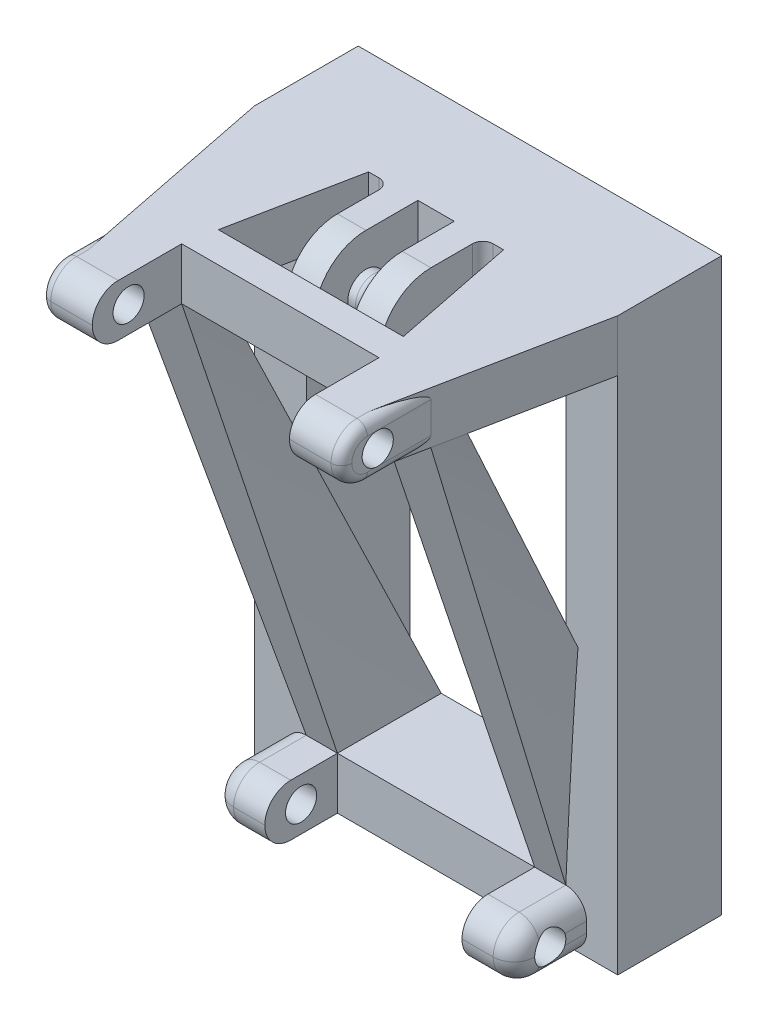
from build123d import *
from OCP.BRepFilletAPI import BRepFilletAPI_MakeChamfer

# Parameters (mm, degrees)
SKETCH1_W           = 35
SKETCH1_H           = 55
BOSS_EXTRUDE1_DEPTH = 3
SKETCH2_W           = 5
SKETCH2_H           = 5
BOSS_EXTRUDE2_DEPTH = 7
CUT_EXTRUDE1_REACH  = 45.362
FILLET1_R           = 2.5
SKETCH4_W           = 5
SKETCH4_H           = 5
BOSS_EXTRUDE3_DEPTH = 16.61764706
CUT_EXTRUDE2_REACH  = 51.887
FILLET2_R           = 2.5
FILLET3_R           = 2
CHAMFER1_SIZE       = 3
CHAMFER1_SIZE_2     = 15
FILLET5_R           = 1
SKETCH6_W           = 2.75
SKETCH6_H           = 10
BOSS_EXTRUDE4_DEPTH = 10
FILLET6_R           = 5
FILLET7_R           = 1
BOSS_EXTRUDE5_START = -2.75
BOSS_EXTRUDE5_DEPTH = 1.25
BOSS_EXTRUDE6_START = -4
BOSS_EXTRUDE6_DEPTH = 1.25
CHAMFER2_SIZE       = 3
CHAMFER2_SIZE2      = 15
BOSS_EXTRUDE7_REACH = 48.364
SKETCH10_W          = 3
SKETCH10_H          = 5
SKETCH15_W          = 35
SKETCH15_H          = 55
BOSS_EXTRUDE8_DEPTH = 7
CUT_EXTRUDE5_DEPTH  = 10
BOSS_EXTRUDE9_START = -5
SKETCH19_W          = 5
SKETCH19_H          = 10
BOSS_EXTRUDE9_DEPTH = 55


with BuildPart() as part:
    # Sketch1 → Boss-Extrude1 (new body)
    with BuildSketch(Plane.XY):
        Rectangle(SKETCH1_W, SKETCH1_H)
    extrude(amount=BOSS_EXTRUDE1_DEPTH)

    # Sketch2 → Boss-Extrude2 (add)
    with BuildSketch(Plane.XY.offset(3)):
        with Locations((-12, 25)):
            Rectangle(SKETCH2_W, SKETCH2_H)
        with Locations((12, 25)):
            Rectangle(SKETCH2_W, SKETCH2_H)
        with Locations((-12, -25)):
            Rectangle(SKETCH2_W, SKETCH2_H)
        with Locations((12, -25)):
            Rectangle(SKETCH2_W, SKETCH2_H)
    extrude(amount=BOSS_EXTRUDE2_DEPTH)

    # Cut-Extrude1: up to this face of the body (flat: up to its plane)
    cut_extrude1_end = Plane(part.part.faces().sort_by_distance((14.5, 25, 6.5))[0])
    # Sketch3 → Cut-Extrude1 (cut, up to the picked face)
    with BuildSketch(Plane.ZY.offset(14.5), mode=Mode.PRIVATE) as cut_extrude1_sk1:
        with BuildLine():
            ThreePointArc((8, -25), (6.957766147, -23.571556737), (5.279399793, -24.128142709))
            Line((5.279399793, -24.128142709), (7.720600207, -25.871857291))
            ThreePointArc((7.720600207, -25.871857291), (7.928443263, -25.457766147), (8, -25))
        make_face()
    cut_extrude1_tool1 = split(extrude(cut_extrude1_sk1.sketch, amount=-CUT_EXTRUDE1_REACH, mode=Mode.PRIVATE), bisect_by=cut_extrude1_end, keep=Keep.BOTH, mode=Mode.PRIVATE)
    # Sketch3 → Cut-Extrude1 (cut, up to the picked face)
    with BuildSketch(Plane.ZY.offset(14.5), mode=Mode.PRIVATE) as cut_extrude1_sk2:
        with BuildLine():
            Line((7.720600207, -25.871857291), (5.279399793, -24.128142709))
            ThreePointArc((5.279399793, -24.128142709), (5.628142709, -26.220600207), (7.720600207, -25.871857291))
        make_face()
    cut_extrude1_tool2 = split(extrude(cut_extrude1_sk2.sketch, amount=-CUT_EXTRUDE1_REACH, mode=Mode.PRIVATE), bisect_by=cut_extrude1_end, keep=Keep.BOTH, mode=Mode.PRIVATE)
    # Sketch3 → Cut-Extrude1 (cut, up to the picked face)
    with BuildSketch(Plane.ZY.offset(14.5), mode=Mode.PRIVATE) as cut_extrude1_sk3:
        with BuildLine():
            ThreePointArc((8, -25), (6.957766147, -23.571556737), (5.279399793, -24.128142709))
            Line((5.279399793, -24.128142709), (7.720600207, -25.871857291))
            ThreePointArc((7.720600207, -25.871857291), (7.928443263, -25.457766147), (8, -25))
        make_face()
    cut_extrude1_tool3 = split(extrude(cut_extrude1_sk3.sketch, amount=-CUT_EXTRUDE1_REACH, mode=Mode.PRIVATE), bisect_by=cut_extrude1_end, keep=Keep.BOTH, mode=Mode.PRIVATE)
    # Sketch3 → Cut-Extrude1 (cut, up to the picked face)
    with BuildSketch(Plane.ZY.offset(14.5), mode=Mode.PRIVATE) as cut_extrude1_sk4:
        with BuildLine():
            Line((7.720600207, -25.871857291), (5.279399793, -24.128142709))
            ThreePointArc((5.279399793, -24.128142709), (5.628142709, -26.220600207), (7.720600207, -25.871857291))
        make_face()
    cut_extrude1_tool4 = split(extrude(cut_extrude1_sk4.sketch, amount=-CUT_EXTRUDE1_REACH, mode=Mode.PRIVATE), bisect_by=cut_extrude1_end, keep=Keep.BOTH, mode=Mode.PRIVATE)
    add(cut_extrude1_tool1.solids().sort_by(Axis((-14.5, -24.481961, 6.870028), (1, 0, 0)))[0], mode=Mode.SUBTRACT)
    add(cut_extrude1_tool2.solids().sort_by(Axis((-14.5, -25.518039, 6.129972), (1, 0, 0)))[0], mode=Mode.SUBTRACT)
    add(cut_extrude1_tool3.solids().sort_by(Axis((-14.5, -24.481961, 6.870028), (1, 0, 0)))[0], mode=Mode.SUBTRACT)
    add(cut_extrude1_tool4.solids().sort_by(Axis((-14.5, -25.518039, 6.129972), (1, 0, 0)))[0], mode=Mode.SUBTRACT)

    # Fillet1
    fillet1_edges = [part.edges().sort_by_distance(p)[0] for p in [
        (12, -27.5, 10),
        (12, -22.5, 10),
        (-12, -27.5, 10),
        (-12, -22.5, 10),
    ]]
    fillet(fillet1_edges, radius=FILLET1_R - 0.0001)  # a hair under: the kernel refuses the full size

    # Sketch4 → Boss-Extrude3 (add)
    with BuildSketch(Plane.XY.offset(10)):
        with Locations((-12, 25)):
            Rectangle(SKETCH4_W, SKETCH4_H)
        with Locations((12, 25)):
            Rectangle(SKETCH4_W, SKETCH4_H)
    extrude(amount=BOSS_EXTRUDE3_DEPTH)

    # Cut-Extrude2: up to this face of the body (flat: up to its plane)
    cut_extrude2_end = Plane(part.part.faces().sort_by_distance((14.5, 25, 14.80882353))[0])
    # Sketch5 → Cut-Extrude2 (cut, up to the picked face)
    with BuildSketch(Plane.ZY.offset(14.5), mode=Mode.PRIVATE) as cut_extrude2_sk1:
        with BuildLine():
            ThreePointArc((24.61764706, 25), (23.575413207, 26.428443263), (21.897046853, 25.871857291))
            Line((21.897046853, 25.871857291), (24.338247267, 24.128142709))
            ThreePointArc((24.338247267, 24.128142709), (24.546090323, 24.542233853), (24.61764706, 25))
        make_face()
    cut_extrude2_tool1 = split(extrude(cut_extrude2_sk1.sketch, amount=-CUT_EXTRUDE2_REACH, mode=Mode.PRIVATE), bisect_by=cut_extrude2_end, keep=Keep.BOTH, mode=Mode.PRIVATE)
    # Sketch5 → Cut-Extrude2 (cut, up to the picked face)
    with BuildSketch(Plane.ZY.offset(14.5), mode=Mode.PRIVATE) as cut_extrude2_sk2:
        with BuildLine():
            Line((24.338247267, 24.128142709), (21.897046853, 25.871857291))
            ThreePointArc((21.897046853, 25.871857291), (22.245789769, 23.779399793), (24.338247267, 24.128142709))
        make_face()
    cut_extrude2_tool2 = split(extrude(cut_extrude2_sk2.sketch, amount=-CUT_EXTRUDE2_REACH, mode=Mode.PRIVATE), bisect_by=cut_extrude2_end, keep=Keep.BOTH, mode=Mode.PRIVATE)
    # Sketch5 → Cut-Extrude2 (cut, up to the picked face)
    with BuildSketch(Plane.ZY.offset(14.5), mode=Mode.PRIVATE) as cut_extrude2_sk3:
        with BuildLine():
            ThreePointArc((24.61764706, 25), (23.575413207, 26.428443263), (21.897046853, 25.871857291))
            Line((21.897046853, 25.871857291), (24.338247267, 24.128142709))
            ThreePointArc((24.338247267, 24.128142709), (24.546090323, 24.542233853), (24.61764706, 25))
        make_face()
    cut_extrude2_tool3 = split(extrude(cut_extrude2_sk3.sketch, amount=-CUT_EXTRUDE2_REACH, mode=Mode.PRIVATE), bisect_by=cut_extrude2_end, keep=Keep.BOTH, mode=Mode.PRIVATE)
    # Sketch5 → Cut-Extrude2 (cut, up to the picked face)
    with BuildSketch(Plane.ZY.offset(14.5), mode=Mode.PRIVATE) as cut_extrude2_sk4:
        with BuildLine():
            Line((24.338247267, 24.128142709), (21.897046853, 25.871857291))
            ThreePointArc((21.897046853, 25.871857291), (22.245789769, 23.779399793), (24.338247267, 24.128142709))
        make_face()
    cut_extrude2_tool4 = split(extrude(cut_extrude2_sk4.sketch, amount=-CUT_EXTRUDE2_REACH, mode=Mode.PRIVATE), bisect_by=cut_extrude2_end, keep=Keep.BOTH, mode=Mode.PRIVATE)
    add(cut_extrude2_tool1.solids().sort_by(Axis((-14.5, 25.518039, 23.487675), (1, 0, 0)))[0], mode=Mode.SUBTRACT)
    add(cut_extrude2_tool2.solids().sort_by(Axis((-14.5, 24.481961, 22.747619), (1, 0, 0)))[0], mode=Mode.SUBTRACT)
    add(cut_extrude2_tool3.solids().sort_by(Axis((-14.5, 25.518039, 23.487675), (1, 0, 0)))[0], mode=Mode.SUBTRACT)
    add(cut_extrude2_tool4.solids().sort_by(Axis((-14.5, 24.481961, 22.747619), (1, 0, 0)))[0], mode=Mode.SUBTRACT)

    # Fillet2
    fillet2_edges = [part.edges().sort_by_distance(p)[0] for p in [
        (12, 22.5, 26.61764706),
        (12, 27.5, 26.61764706),
        (-12, 22.5, 26.61764706),
        (-12, 27.5, 26.61764706),
    ]]
    fillet(fillet2_edges, radius=FILLET2_R - 0.0001)  # a hair under: the kernel refuses the full size

    # Fillet3
    # the kernel refuses this fillet: 2 mm, written as the material it takes off along each edge
    with BuildSketch(Plane(origin=(14.5, -22.5, 3), x_dir=(0, -1, 0), z_dir=(0, 0, 1)), Plane(origin=(14.5, -27.5, 3), x_dir=(-1, 0, 0), z_dir=(0, 0, 1)), Plane(origin=(-14.5, -22.5, 3), x_dir=(1, 0, 0), z_dir=(0, 0, 1))) as fillet3_piece_1:
        with BuildLine():
            CenterArc((FILLET3_R, -FILLET3_R), FILLET3_R, 90, 90)
            Line((0, -FILLET3_R), (0, 0))
            Line((0, 0), (FILLET3_R, 0))
        make_face()
    extrude(amount=4.5001, mode=Mode.SUBTRACT)
    with BuildSketch(Plane(origin=(14.5, -24.9999, 7.5001), x_dir=(0, 0, 1), z_dir=(0, -1, 0))) as fillet3_piece_2:
        with BuildLine():
            CenterArc((2.4999 - FILLET3_R, FILLET3_R), FILLET3_R, 270, 90)
            Line((2.4999, FILLET3_R), (2.4999, 0))
            Line((2.4999, 0), (2.4999 - FILLET3_R, 0))
        make_face()
    revolve(axis=Axis((14.5, -24.9999, 7.5001), (-1, 0, 0)), revolution_arc=90, mode=Mode.SUBTRACT)
    with BuildSketch(Plane(origin=(14.5, -25.0001, 7.5001), x_dir=(0, -1, 0), z_dir=(0, 0, -1))) as fillet3_piece_3:
        with BuildLine():
            CenterArc((2.4999 - FILLET3_R, FILLET3_R), FILLET3_R, 270, 90)
            Line((2.4999, FILLET3_R), (2.4999, 0))
            Line((2.4999, 0), (2.4999 - FILLET3_R, 0))
        make_face()
    revolve(axis=Axis((14.5, -25.0001, 7.5001), (-1, 0, 0)), revolution_arc=90, mode=Mode.SUBTRACT)
    with BuildSketch(Plane(origin=(-14.5, -27.5, 3), x_dir=(1, 0, 0), z_dir=(0, 0, 1))) as fillet3_piece_4:
        with BuildLine():
            CenterArc((FILLET3_R, FILLET3_R), FILLET3_R, 180, 90)
            Line((0, FILLET3_R), (0, 0))
            Line((0, 0), (FILLET3_R, 0))
        make_face()
    extrude(amount=4.5001, mode=Mode.SUBTRACT)
    with BuildSketch(Plane(origin=(-14.5, -24.9999, 7.5001), x_dir=(0, 0, 1), z_dir=(0, -1, 0))) as fillet3_piece_5:
        with BuildLine():
            CenterArc((2.4999 - FILLET3_R, -FILLET3_R), FILLET3_R, 0, 90)
            Line((2.4999, -FILLET3_R), (2.4999, 0))
            Line((2.4999, 0), (2.4999 - FILLET3_R, 0))
        make_face()
    revolve(axis=Axis((-14.5, -24.9999, 7.5001), (-1, 0, 0)), revolution_arc=90, mode=Mode.SUBTRACT)
    with BuildSketch(Plane(origin=(-14.5, -25.0001, 7.5001), x_dir=(0, -1, 0), z_dir=(0, 0, -1))) as fillet3_piece_6:
        with BuildLine():
            CenterArc((2.4999 - FILLET3_R, -FILLET3_R), FILLET3_R, 0, 90)
            Line((2.4999, -FILLET3_R), (2.4999, 0))
            Line((2.4999, 0), (2.4999 - FILLET3_R, 0))
        make_face()
    revolve(axis=Axis((-14.5, -25.0001, 7.5001), (-1, 0, 0)), revolution_arc=90, mode=Mode.SUBTRACT)
    with BuildSketch(Plane(origin=(-14.5, -25.0001, 10), x_dir=(0, 0, -1), z_dir=(0, 1, 0))) as fillet3_piece_7:
        with BuildLine():
            CenterArc((FILLET3_R, -FILLET3_R), FILLET3_R, 90, 90)
            Line((0, -FILLET3_R), (0, 0))
            Line((0, 0), (FILLET3_R, 0))
        make_face()
    extrude(amount=0.0002, mode=Mode.SUBTRACT)
    with BuildSketch(Plane(origin=(14.5, -25.0001, 10), x_dir=(0, 0, -1), z_dir=(0, 1, 0))) as fillet3_piece_8:
        with BuildLine():
            CenterArc((FILLET3_R, FILLET3_R), FILLET3_R, 180, 90)
            Line((0, FILLET3_R), (0, 0))
            Line((0, 0), (FILLET3_R, 0))
        make_face()
    extrude(amount=0.0002, mode=Mode.SUBTRACT)

    # Chamfer1
    chamfer1_edges_1 = [part.edges().sort_by_distance(p)[0] for p in [
        (-14.5, 25, 3),
    ]]
    chamfer1_side_1 = [part.faces().sort_by_distance(p)[0] for p in [
        (-14.56, 25, 3),
    ]]
    chamfer1_edges_2 = [part.edges().sort_by_distance(p)[0] for p in [
        (14.5, 25, 3),
    ]]
    chamfer1_side_2 = [part.faces().sort_by_distance(p)[0] for p in [
        (14.5, 25, 3.06),
    ]]
    chamfer1 = BRepFilletAPI_MakeChamfer(part.part.solid().wrapped)
    for e in chamfer1_edges_1:
        chamfer1.Add(CHAMFER1_SIZE - 0.0001, CHAMFER1_SIZE_2 - 0.0001, e.wrapped, chamfer1_side_1[0].wrapped)
    for e in chamfer1_edges_2:
        chamfer1.Add(CHAMFER1_SIZE_2 - 0.0001, CHAMFER1_SIZE - 0.0001, e.wrapped, chamfer1_side_2[0].wrapped)
    add(Compound.cast(chamfer1.Shape()), mode=Mode.REPLACE)  # a hair under: the kernel refuses the full size

    # Fillet5
    fillet5_edges = [part.edges().sort_by_distance(p)[0] for p in [
        (14.5, 27.5, 21.05882353),
        (14.5, 22.5, 21.05882353),
        (14.5, 26.767796242, 25.885443302),
        (14.5, 23.232203758, 25.885443302),
        (-14.5, 27.5, 21.05882353),
        (-14.5, 22.5, 21.05882353),
        (-14.5, 26.767796242, 25.885443302),
        (-14.5, 23.232203758, 25.885443302),
    ]]
    fillet(fillet5_edges, radius=FILLET5_R - 0.0001)  # a hair under: the kernel refuses the full size

    # Sketch6 → Boss-Extrude4 (add)
    with BuildSketch(Plane.XY.offset(3)):
        with Locations((-3.125, 22.5)):
            Rectangle(SKETCH6_W, SKETCH6_H)
        with Locations((3.125, 22.5)):
            Rectangle(SKETCH6_W, SKETCH6_H)
    extrude(amount=BOSS_EXTRUDE4_DEPTH)

    # Fillet6
    fillet6_edges = [part.edges().sort_by_distance(p)[0] for p in [
        (-3.125, 17.5, 13),
        (3.125, 17.5, 13),
        (3.125, 27.5, 13),
        (-3.125, 27.5, 13),
    ]]
    fillet(fillet6_edges, radius=FILLET6_R - 0.0001)  # a hair under: the kernel refuses the full size

    # Fillet7
    fillet7_edges = [part.edges().sort_by_distance(p)[0] for p in [
        (-4.5, 22.5, 3),
        (4.5, 22.5, 3),
    ]]
    fillet(fillet7_edges, radius=FILLET7_R)

    # Sketch7 → Boss-Extrude5 (add)
    with BuildSketch(Plane.ZY.offset(4.5).offset(BOSS_EXTRUDE5_START)):
        with BuildLine():
            ThreePointArc((9.75, 22.5), (8.669696007, 24.116789182), (6.762563133, 23.737436867))
            Line((6.762563133, 23.737436867), (9.237436867, 21.262563133))
            ThreePointArc((9.237436867, 21.262563133), (9.616789182, 21.830303993), (9.75, 22.5))
        make_face()
        with BuildLine():
            Line((9.237436867, 21.262563133), (6.762563133, 23.737436867))
            ThreePointArc((6.762563133, 23.737436867), (6.762563133, 21.262563133), (9.237436867, 21.262563133))
        make_face()
    extrude(amount=-BOSS_EXTRUDE5_DEPTH)

    # Sketch9 → Boss-Extrude6 (add)
    with BuildSketch(Plane(origin=(4.5, 0, 0), x_dir=(0, 0, -1), z_dir=(1, 0, 0)).offset(BOSS_EXTRUDE6_START)):
        with BuildLine():
            ThreePointArc((-8, 24.25), (-9.75, 22.5), (-8, 20.75))
            Line((-8, 20.75), (-8, 24.25))
        make_face()
        with BuildLine():
            Line((-8, 24.25), (-8, 20.75))
            ThreePointArc((-8, 20.75), (-6.762563133, 21.262563133), (-6.25, 22.5))
            ThreePointArc((-6.25, 22.5), (-6.762563133, 23.737436867), (-8, 24.25))
        make_face()
    extrude(amount=BOSS_EXTRUDE6_DEPTH)

    # Chamfer2
    chamfer2_edges = [part.edges().sort_by_distance(p)[0] for p in [
        (-9.5, 25, 3),
        (9.5, 25, 3),
    ]]
    chamfer2_side = [part.faces().sort_by_distance(p)[0] for p in [
        (0, -1.464120363, 3),
    ]]
    chamfer(chamfer2_edges, length=CHAMFER2_SIZE, length2=CHAMFER2_SIZE2, reference=chamfer2_side[0])

    # Boss-Extrude7: up to this plane
    boss_extrude7_end = Plane(origin=(-9.5, 27.5, 18), z_dir=(0.9805806756909196, 0, 0.19611613513818726))
    # Sketch10 → Boss-Extrude7 (add, up to the surface)
    with BuildSketch(Plane(origin=(5.673076923, 0, -1.134615385), x_dir=(0.1961161351381873, 0, 0.9805806756909196), z_dir=(-0.9805806756909196, 0, 0.1961161351381873)), mode=Mode.PRIVATE) as boss_extrude7_sk1:
        with Locations((18.013555446, 25)):
            Rectangle(SKETCH10_W, SKETCH10_H)
    boss_extrude7_tool1 = split(extrude(boss_extrude7_sk1.sketch, amount=BOSS_EXTRUDE7_REACH, dir=(-1, 0, 0), mode=Mode.PRIVATE), bisect_by=boss_extrude7_end, keep=Keep.BOTH, mode=Mode.PRIVATE)
    add(boss_extrude7_tool1.solids().sort_by_distance((9.205826, 25, 16.529129))[0])

    # Fillet8: read off the stored shape, not the designer's step
    # Fillet8 outline → Fillet8 (revolve, cut)
    with BuildSketch(Plane(origin=(0, 22.5, 8), x_dir=(0, 1, 0), z_dir=(0, 0, -1))):
        with BuildLine():
            ThreePointArc((1.75, 1), (1.603553391, 0.646446609), (1.25, 0.5))
            Line((1.25, 0.5), (1.75, 0.5))
            Line((1.75, 0.5), (1.75, 1))
        make_face()
        with BuildLine():
            Line((1.75, -0.5), (1.25, -0.5))
            ThreePointArc((1.25, -0.5), (1.603553391, -0.646446609), (1.75, -1))
            Line((1.75, -1), (1.75, -0.5))
        make_face()
    revolve(axis=Axis((0, 22.5, 8), (1, 0, 0)), mode=Mode.SUBTRACT)

    # Sketch15 → Boss-Extrude8 (add)
    with BuildSketch(Plane(origin=(0, 0, 0), x_dir=(-1, 0, 0), z_dir=(0, 0, -1))):
        Rectangle(SKETCH15_W, SKETCH15_H)
    extrude(amount=BOSS_EXTRUDE8_DEPTH)

    # Sketch16 → Cut-Extrude5 (cut)
    with BuildSketch(Plane.XY.offset(3)):
        Polygon((-17.5, 22.5), (-17.5, 17.5), (-5.5, 17.5), align=None)
        Polygon((17.5, 22.5), (5.5, 17.5), (17.5, 17.5), align=None)
        Polygon((-17.5, 17.5), (-17.5, -22.5), (-12.5, -22.5), (-9.5, -22.5), (9.5, -22.5), (12.5, -22.5), (17.5, -22.5), (17.5, 17.5), (5.5, 17.5), (1.75, 17.5), (-1.75, 17.5), (-5.5, 17.5), align=None)
    extrude(amount=-CUT_EXTRUDE5_DEPTH, mode=Mode.SUBTRACT)


with BuildPart() as cut_extrude5_piece_1:
    # of the separate pieces the step leaves, piece 1, a body of its own (cut_extrude5_pieces)
    add(part.part.solids().sort_by_distance((6.5, 27.5, 3))[0])



with BuildPart() as cut_extrude5_piece_2:
    # of the separate pieces the step leaves, piece 2, a body of its own (cut_extrude5_pieces)
    add(part.part.solids().sort_by_distance((17.5, -27.5, 3))[0])


with BuildPart() as cut_extrude5_piece_1_1:
    add(cut_extrude5_piece_1.part)

    add(cut_extrude5_piece_2.part)  # Loft3 merges Cut-Extrude5 piece 2
    # Sketch13 → Loft3 section 0
    with BuildSketch(Plane.XZ.offset(-22.5)):
        with BuildLine():
            Line((9.5, 18), (8.911651595, 15.058257973))
            Line((8.911651595, 15.058257973), (15.088348405, 15.058257973))
            Line((15.088348405, 15.058257973), (14.5, 18))
            Line((14.5, 18), (9.5, 18))
        make_face()
    # Sketch17 → Loft3 section 1
    with BuildSketch(Plane(origin=(0, -22.5, 0), x_dir=(1, 0, 0), z_dir=(0, 1, 0))):
        with BuildLine():
            Line((12.5, -3), (9.5, -3))
            Line((9.5, -3), (9.5, 7))
            Line((9.5, 7), (12.5, 7))
            Line((12.5, 7), (12.5, -3))
        make_face()
    loft()

    # Sketch12 → Loft4 section 0
    with BuildSketch(Plane.XZ.offset(-22.5)):
        with BuildLine():
            Line((-9.5, 18), (-8.911651595, 15.058257973))
            Line((-8.911651595, 15.058257973), (-15.088348405, 15.058257973))
            Line((-15.088348405, 15.058257973), (-14.5, 18))
            Line((-14.5, 18), (-9.5, 18))
        make_face()
    # Sketch18 → Loft4 section 1
    with BuildSketch(Plane(origin=(0, -22.5, 0), x_dir=(1, 0, 0), z_dir=(0, 1, 0))):
        with BuildLine():
            Line((-12.5, -3), (-9.5, -3))
            Line((-9.5, -3), (-9.5, 7))
            Line((-9.5, 7), (-12.5, 7))
            Line((-12.5, 7), (-12.5, -3))
        make_face()
    loft()

    # Sketch19 → Boss-Extrude9 (add)
    with BuildSketch(Plane(origin=(0, -22.5, 0), x_dir=(1, 0, 0), z_dir=(0, 1, 0)).offset(BOSS_EXTRUDE9_START)):
        with Locations((15, 2)):
            Rectangle(SKETCH19_W, SKETCH19_H)
        with Locations((-15, 2)):
            Rectangle(SKETCH19_W, SKETCH19_H)
    extrude(amount=BOSS_EXTRUDE9_DEPTH)


solid = cut_extrude5_piece_1_1.part
